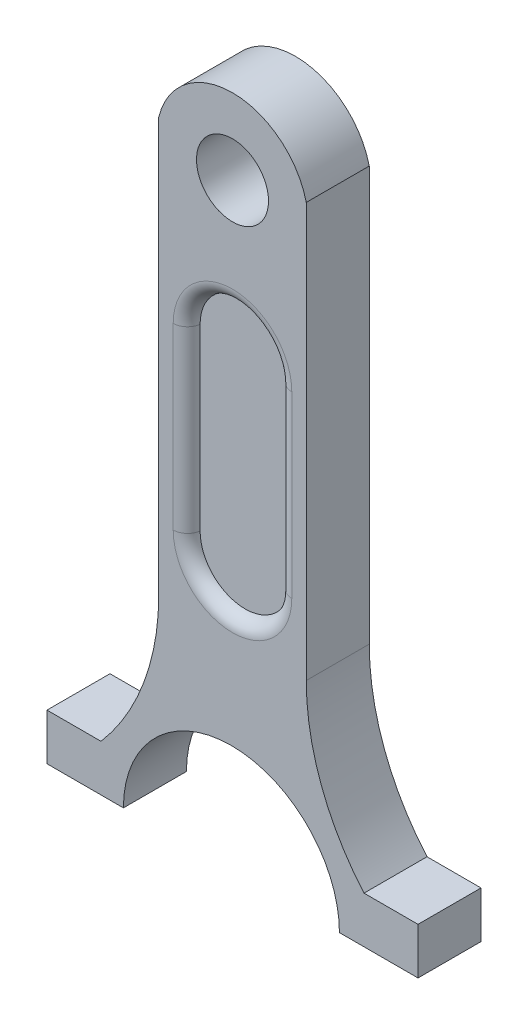
from build123d import *

# Parameters (mm, degrees)
SKETCH2_R           = 5.08
BOSS_EXTRUDE1_DEPTH = 8.89
CUT_EXTRUDE1_DEPTH  = 8.89
CUT_EXTRUDE4_DEPTH  = 1.778
CUT_EXTRUDE5_START  = -1.778
CUT_EXTRUDE5_DEPTH  = 1.778
SKETCH13_W          = 8.89
SKETCH13_H          = 6.560107066
BOSS_EXTRUDE6_DEPTH = 7.62
SKETCH14_W          = 8.89
SKETCH14_H          = 6.560107066
BOSS_EXTRUDE7_DEPTH = 7.62
FILLET1_R           = 2.032
SKETCH15_R          = 3.556
CUT_EXTRUDE6_DEPTH  = 3.81


with BuildPart() as part:
    # Sketch2 → Boss-Extrude1 (new body)
    with BuildSketch(Plane.XY):
        with BuildLine():
            Line((-10.406791551, -8.202588674), (-10.406791551, -66.622588674))
            ThreePointArc((-10.406791551, -66.622588674), (-12.510019722, -78.309204867), (-18.555768436, -88.529258158))
            Line((-18.555768436, -88.529258158), (-18.555768436, -95.089365224))
            Line((-18.555768436, -95.089365224), (18.555768436, -95.089365224))
            Line((18.555768436, -95.089365224), (18.555768436, -88.529258158))
            ThreePointArc((18.555768436, -88.529258158), (12.510019722, -78.309204867), (10.406791551, -66.622588674))
            Line((10.406791551, -66.622588674), (10.406791551, -8.202588674))
            ThreePointArc((10.406791551, -8.202588674), (0, 0), (-10.406791551, -8.202588674))
        make_face()
        with Locations((0, -10.702948686)):
            Circle(SKETCH2_R, mode=Mode.SUBTRACT)
    extrude(amount=BOSS_EXTRUDE1_DEPTH)

    # Sketch3 → Cut-Extrude1 (cut)
    with BuildSketch(Plane.XY.offset(8.89)):
        with BuildLine():
            Line((-15.392321471, -95.089365224), (15.087678529, -95.089365224))
            ThreePointArc((15.087678529, -95.089365224), (-0.152321471, -79.849365224), (-15.392321471, -95.089365224))
        make_face()
    extrude(amount=-CUT_EXTRUDE1_DEPTH, mode=Mode.SUBTRACT)

    # Sketch8 → Cut-Extrude4 (cut)
    with BuildSketch(Plane.XY.offset(8.89)):
        with BuildLine():
            Line((-6.35, -32.367098726), (-6.35, -57.618798646))
            ThreePointArc((-6.35, -57.618798646), (0, -63.968798646), (6.35, -57.618798646))
            Line((6.35, -57.618798646), (6.35, -32.367098726))
            ThreePointArc((6.35, -32.367098726), (0, -26.017098726), (-6.35, -32.367098726))
        make_face()
    extrude(amount=-CUT_EXTRUDE4_DEPTH, mode=Mode.SUBTRACT)

    # Sketch9 → Cut-Extrude5 (cut)
    with BuildSketch(Plane(origin=(0, 0, 0), x_dir=(-1, 0, 0), z_dir=(0, 0, -1)).offset(CUT_EXTRUDE5_START)):
        with BuildLine():
            Line((6.35, -57.618798646), (6.35, -32.367098726))
            ThreePointArc((6.35, -32.367098726), (0, -26.017098726), (-6.35, -32.367098726))
            Line((-6.35, -32.367098726), (-6.35, -57.618798646))
            ThreePointArc((-6.35, -57.618798646), (0, -63.968798646), (6.35, -57.618798646))
        make_face()
    extrude(amount=CUT_EXTRUDE5_DEPTH, mode=Mode.SUBTRACT)

    # Sketch13 → Boss-Extrude6 (add)
    with BuildSketch(Plane.ZY.offset(18.555768436)):
        with Locations((4.445, -91.809311691)):
            Rectangle(SKETCH13_W, SKETCH13_H)
    extrude(amount=BOSS_EXTRUDE6_DEPTH)

    # Sketch14 → Boss-Extrude7 (add)
    with BuildSketch(Plane(origin=(18.555768436, 0, 0), x_dir=(0, 0, -1), z_dir=(1, 0, 0))):
        with Locations((-4.445, -91.809311691)):
            Rectangle(SKETCH14_W, SKETCH14_H)
    extrude(amount=BOSS_EXTRUDE7_DEPTH)

    # Fillet1
    # the kernel refuses this fillet: 2.032 mm, written as the material it takes off along each edge
    with BuildSketch(Plane(origin=(0, -57.618798646, 0), x_dir=(1, 0, 0), z_dir=(0, 1, 0))) as fillet1_piece_1:
        with BuildLine():
            CenterArc((8.366062499, -2.032), FILLET1_R, 90, 82.819244219)
            Line((6.35, -1.778), (6.30967875, -1.77292))
            ThreePointArc((6.30967875, -1.77292), (6.30936, -0.889), (6.30936, 0))
            Line((6.30936, 0), (6.35, 0.04064))
            Line((6.35, 0.04064), (8.366062499, 0.04064))
            Line((8.366062499, 0.04064), (8.366062499, 0))
        make_face()
    revolve(axis=Axis((0, -57.618798646, 0), (0, 0, -1)), revolution_arc=180, mode=Mode.SUBTRACT)
    with BuildSketch(Plane(origin=(-6.35, -57.618798646, 0), x_dir=(-1, 0, 0), z_dir=(0, 1, 0)), Plane(origin=(6.35, -32.367098726, 0), x_dir=(1, 0, 0), z_dir=(0, -1, 0)), Plane(origin=(-6.35, -32.367098726, 8.89), x_dir=(-1, 0, 0), z_dir=(0, -1, 0)), Plane(origin=(6.35, -57.618798646, 8.89), x_dir=(1, 0, 0), z_dir=(0, 1, 0))) as fillet1_piece_2:
        with BuildLine():
            CenterArc((2.016062499, 2.032), FILLET1_R, 187.180755781, 82.819244219)
            Line((0, 1.778), (-0.04032125, 1.77292))
            ThreePointArc((-0.04032125, 1.77292), (-0.04064, 0.889), (-0.04064, 0))
            Line((-0.04064, 0), (0, -0.04064))
            Line((0, -0.04064), (2.016062499, -0.04064))
            Line((2.016062499, -0.04064), (2.016062499, 0))
        make_face()
    extrude(amount=25.251699921, mode=Mode.SUBTRACT)
    with BuildSketch(Plane(origin=(0, -32.367098726, 0), x_dir=(-1, 0, 0), z_dir=(0, -1, 0))) as fillet1_piece_3:
        with BuildLine():
            CenterArc((8.366062499, -2.032), FILLET1_R, 90, 82.819244219)
            Line((6.35, -1.778), (6.30967875, -1.77292))
            ThreePointArc((6.30967875, -1.77292), (6.30936, -0.889), (6.30936, 0))
            Line((6.30936, 0), (6.35, 0.04064))
            Line((6.35, 0.04064), (8.366062499, 0.04064))
            Line((8.366062499, 0.04064), (8.366062499, 0))
        make_face()
    revolve(axis=Axis((0, -32.367098726, 0), (0, 0, -1)), revolution_arc=180, mode=Mode.SUBTRACT)
    with BuildSketch(Plane(origin=(0, -32.367098726, 8.89), x_dir=(1, 0, 0), z_dir=(0, -1, 0))) as fillet1_piece_4:
        with BuildLine():
            CenterArc((8.366062499, -2.032), FILLET1_R, 90, 82.819244219)
            Line((6.35, -1.778), (6.30967875, -1.77292))
            ThreePointArc((6.30967875, -1.77292), (6.30936, -0.889), (6.30936, 0))
            Line((6.30936, 0), (6.35, 0.04064))
            Line((6.35, 0.04064), (8.366062499, 0.04064))
            Line((8.366062499, 0.04064), (8.366062499, 0))
        make_face()
    revolve(axis=Axis((0, -32.367098726, 8.89), (0, 0, 1)), revolution_arc=180, mode=Mode.SUBTRACT)
    with BuildSketch(Plane(origin=(0, -57.618798646, 8.89), x_dir=(-1, 0, 0), z_dir=(0, 1, 0))) as fillet1_piece_5:
        with BuildLine():
            CenterArc((8.366062499, -2.032), FILLET1_R, 90, 82.819244219)
            Line((6.35, -1.778), (6.30967875, -1.77292))
            ThreePointArc((6.30967875, -1.77292), (6.30936, -0.889), (6.30936, 0))
            Line((6.30936, 0), (6.35, 0.04064))
            Line((6.35, 0.04064), (8.366062499, 0.04064))
            Line((8.366062499, 0.04064), (8.366062499, 0))
        make_face()
    revolve(axis=Axis((0, -57.618798646, 8.89), (0, 0, 1)), revolution_arc=180, mode=Mode.SUBTRACT)

    # Sketch15 → Cut-Extrude6 (cut)
    with BuildSketch(Plane.XZ.offset(95.089365224)):
        with Locations(Location((-20.784044953, 4.445, 0), (0, 0, 270))):
            Circle(SKETCH15_R)
        with Locations(Location((20.479402012, 4.445, 0), (0, 0, 270))):
            Circle(SKETCH15_R)
    extrude(amount=-CUT_EXTRUDE6_DEPTH, mode=Mode.SUBTRACT)


solid = part.part
